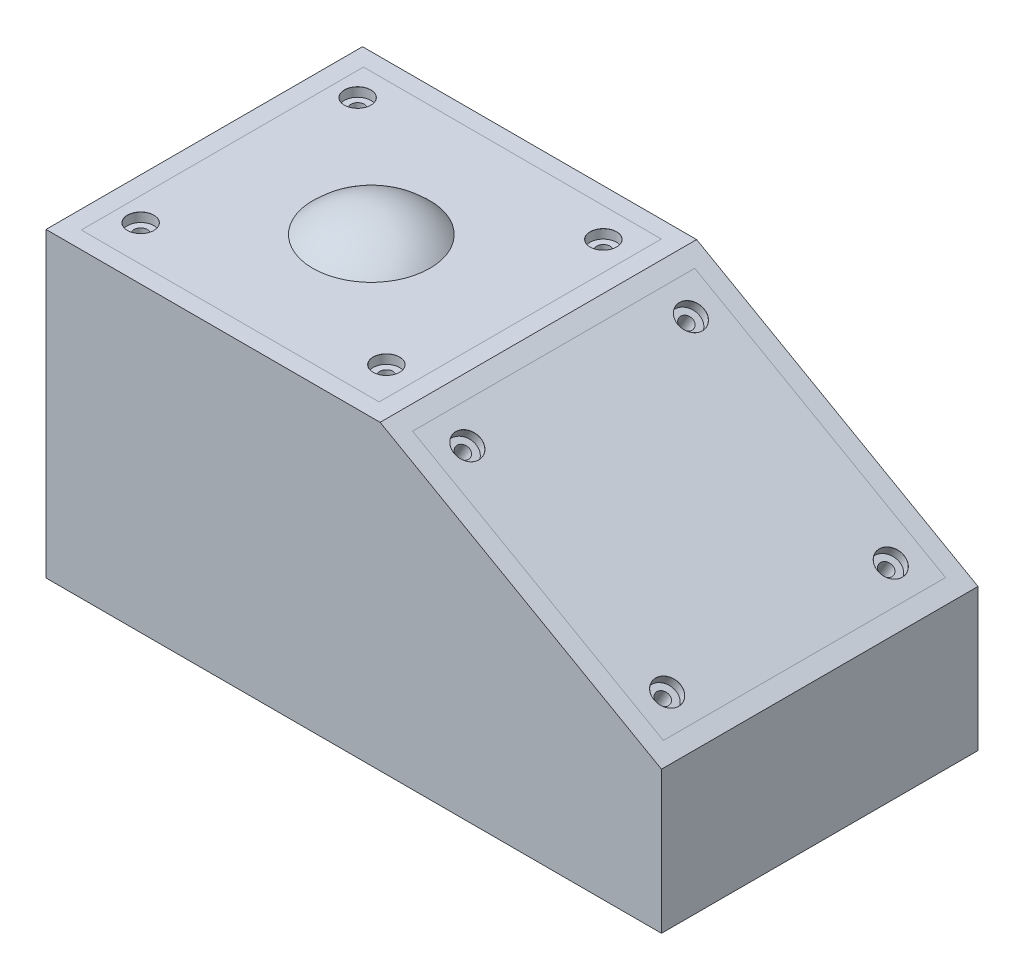
from build123d import *

# Parameters (mm, degrees)
CROQUIS1_W                                     = 210
CROQUIS1_H                                     = 108
SALIENTE_EXTRUIR1_DEPTH                        = 103
CORTAR_EXTRUIR2_DEPTH                          = 108
REFRENTADO_PARA_TORNILLO_CON_CABEZA_2_COUNT    = 2
REFRENTADO_PARA_TORNILLO_CON_CABEZA_2_PITCH    = 76.278637259
REFRENTADO_PARA_TORNILLO_CON_CABEZA_3_COUNT    = 2
REFRENTADO_PARA_TORNILLO_CON_CABEZA_3_PITCH    = 109.392089664
REFRENTADO_PARA_TORNILLO_CON_CABEZA_4_COUNT    = 2
REFRENTADO_PARA_TORNILLO_CON_CABEZA_4_PITCH    = 78.410450701
REFRENTADO_PARA_TORNILLO_CON_CABEZA_5_AT_COUNT = 2
REFRENTADO_PARA_TORNILLO_CON_CABEZA_5_AT_PITCH = 74.028637259
REFRENTADO_PARA_TORNILLO_CON_CABEZA_6_COUNT    = 2
REFRENTADO_PARA_TORNILLO_CON_CABEZA_6_PITCH    = 111.845629414
REFRENTADO_PARA_TORNILLO_CON_CABEZA_7_COUNT    = 2
REFRENTADO_PARA_TORNILLO_CON_CABEZA_7_PITCH    = 83.840358328


# Read off the part's stored shape, not the designer's step: Refrentado para tornillo con cabeza troncocónica de #43
with BuildPart() as part:
    # Croquis1 → Saliente-Extruir1 (new body)
    with BuildSketch(Plane(origin=(0, 0, 0), x_dir=(1, 0, 0), z_dir=(0, 1, 0))):
        with Locations((105, 54)):
            Rectangle(CROQUIS1_W, CROQUIS1_H)
    extrude(amount=SALIENTE_EXTRUIR1_DEPTH)

    # Croquis2 → Cortar-Extruir2 (cut)
    with BuildSketch(Plane.XY):
        Polygon((114, 103), (210, 48.5), (210, 103), align=None)
    extrude(amount=-CORTAR_EXTRUIR2_DEPTH, mode=Mode.SUBTRACT)

    # Croquis11 → Revolución11 (revolve)
    with BuildSketch(Plane(origin=(0, 0, -54), x_dir=(-1, 0, 0), z_dir=(0, 0, -1))):
        with BuildLine():
            Line((-57, 103), (-57, 111.284271247))
            ThreePointArc((-57, 111.284271247), (-67.823922003, 109.131259298), (-77, 103))
            Line((-77, 103), (-57, 103))
        make_face()
    revolve(axis=Axis((57, 132.747407407, -54), (0, -1, 0)))

    # Croquis23 → Refrentado para tornillo con cabeza tron (revolve, cut)
    with BuildSketch(Plane(origin=(196.094171849, 56.394454523, -92.139318629), x_dir=(-0.8696333599491718, 0.49369810538781117, 0), z_dir=(0, 0, 1))):
        Polygon((0, 0), (0, 11.351936393), (2.25, 10), (2.25, 3.1), (4.5, 3.1), (4.5, 0.02875921), (4.525, 0), align=None)
    refrentado_para_tornillo_con_cabeza_tron = revolve(axis=Axis((199.229154818, 61.916626359, -92.139318629), (-0.4936981053878111, -0.8696333599491718, 0)), mode=Mode.SUBTRACT)

    # Refrentado para tornillo con cabeza  2: Refrentado para tornillo con cabeza tron ×2
    with Locations(*[(0, 0, i * REFRENTADO_PARA_TORNILLO_CON_CABEZA_2_PITCH) for i in range(1, REFRENTADO_PARA_TORNILLO_CON_CABEZA_2_COUNT)]):
        add(refrentado_para_tornillo_con_cabeza_tron, mode=Mode.SUBTRACT)

    # Refrentado para tornillo con cabeza  3: Refrentado para tornillo con cabeza tron ×2
    with Locations(*[Vector(-0.6233388895581213, 0.35387468209289175, 0.6972957321955321) * (i * REFRENTADO_PARA_TORNILLO_CON_CABEZA_3_PITCH) for i in range(1, REFRENTADO_PARA_TORNILLO_CON_CABEZA_3_COUNT)]):
        add(refrentado_para_tornillo_con_cabeza_tron, mode=Mode.SUBTRACT)

    # Refrentado para tornillo con cabeza  4: Refrentado para tornillo con cabeza tron ×2
    with Locations(*[Vector(-0.8696333599491719, 0.49369810538781106, 0) * (i * REFRENTADO_PARA_TORNILLO_CON_CABEZA_4_PITCH) for i in range(1, REFRENTADO_PARA_TORNILLO_CON_CABEZA_4_COUNT)]):
        add(refrentado_para_tornillo_con_cabeza_tron, mode=Mode.SUBTRACT)

    # Croquis26 → Refrentado para tornillo con cabeza  5 (revolve, cut)
    with BuildSketch(Plane(origin=(98.029898951, 103, -92.139318629), x_dir=(0, 0, 1), z_dir=(1, 0, 0))):
        Polygon((0, 0), (0, 11.351936393), (2.25, 10), (2.25, 3.1), (4.5, 3.1), (4.5, 0.02875921), (4.525, 0), align=None)
    refrentado_para_tornillo_con_cabeza_5 = revolve(axis=Axis((98.029898951, 109.35, -92.139318629), (0, -1, 0)), mode=Mode.SUBTRACT)

    # Refrentado para tornillo con cabeza 5 at: Refrentado para tornillo con cabeza  5 ×2
    with Locations(*[(0, 0, i * REFRENTADO_PARA_TORNILLO_CON_CABEZA_5_AT_PITCH) for i in range(1, REFRENTADO_PARA_TORNILLO_CON_CABEZA_5_AT_COUNT)]):
        add(refrentado_para_tornillo_con_cabeza_5, mode=Mode.SUBTRACT)

    # Refrentado para tornillo con cabeza  6: Refrentado para tornillo con cabeza  5 ×2
    with Locations(*[Vector(-0.7496078189874714, 0, 0.6618822536621196) * (i * REFRENTADO_PARA_TORNILLO_CON_CABEZA_6_PITCH) for i in range(1, REFRENTADO_PARA_TORNILLO_CON_CABEZA_6_COUNT)]):
        add(refrentado_para_tornillo_con_cabeza_5, mode=Mode.SUBTRACT)

    # Refrentado para tornillo con cabeza  7: Refrentado para tornillo con cabeza  5 ×2
    with Locations(*[(-i * REFRENTADO_PARA_TORNILLO_CON_CABEZA_7_PITCH, 0, 0) for i in range(1, REFRENTADO_PARA_TORNILLO_CON_CABEZA_7_COUNT)]):
        add(refrentado_para_tornillo_con_cabeza_5, mode=Mode.SUBTRACT)

    # Refrentado para tornillo con cabeza 8 ou → Refrentado para tornillo con cabeza  8 (revolve, cut)
    with BuildSketch(Plane(origin=(70, 0, -54), x_dir=(1, 0, 0), z_dir=(0, 0, 1))):
        Polygon((1.63195, 10.299425513), (0, 11.28), (0, 0), (3.175, 0), (3.175, 2.032), (1.63195, 2.032), align=None)
    revolve(axis=Axis((70, 0, -54), (0, 1, 0)), mode=Mode.SUBTRACT)

    # Refrentado para tornillo con cabeza  9 → Refrentado para tornillo con cabeza 8 2 (revolve, cut)
    with BuildSketch(Plane(origin=(50, 0, -73.797820485), x_dir=(1, 0, 0), z_dir=(0, 0, 1))):
        Polygon((0, 0), (3.175, 0), (3.175, 2.032), (1.63195, 2.032), (1.63195, 10.299425513), (0, 11.28), align=None)
    revolve(axis=Axis((50, 0, -73.797820485), (0, 1, 0)), mode=Mode.SUBTRACT)

    # Refrentado para tornillo con cabeza  10 → Refrentado para tornillo con cabeza 8 3 (revolve, cut)
    with BuildSketch(Plane(origin=(50, 0, -33.797820485), x_dir=(1, 0, 0), z_dir=(0, 0, 1))):
        Polygon((0, 0), (3.175, 0), (3.175, 2.032), (1.63195, 2.032), (1.63195, 10.299425513), (0, 11.28), align=None)
    revolve(axis=Axis((50, 0, -33.797820485), (0, 1, 0)), mode=Mode.SUBTRACT)

    # Refrentado para tornillo con cabeza  11 → Refrentado para tornillo con cabeza 8 4 (revolve, cut)
    with BuildSketch(Plane(origin=(50, 0, -53.797820485), x_dir=(1, 0, 0), z_dir=(0, 0, 1))):
        Polygon((0, 0), (3.175, 0), (3.175, 2.032), (1.63195, 2.032), (1.63195, 10.299425513), (0, 11.28), align=None)
    revolve(axis=Axis((50, 0, -53.797820485), (0, 1, 0)), mode=Mode.SUBTRACT)

    # Refrentado para tornillo con cabeza  12 → Refrentado para tornillo con cabeza 8 5 (revolve, cut)
    with BuildSketch(Plane(origin=(30, 0, -54), x_dir=(1, 0, 0), z_dir=(0, 0, 1))):
        Polygon((0, 0), (3.175, 0), (3.175, 2.032), (1.63195, 2.032), (1.63195, 10.299425513), (0, 11.28), align=None)
    revolve(axis=Axis((30, 0, -54), (0, 1, 0)), mode=Mode.SUBTRACT)


solid = part.part
